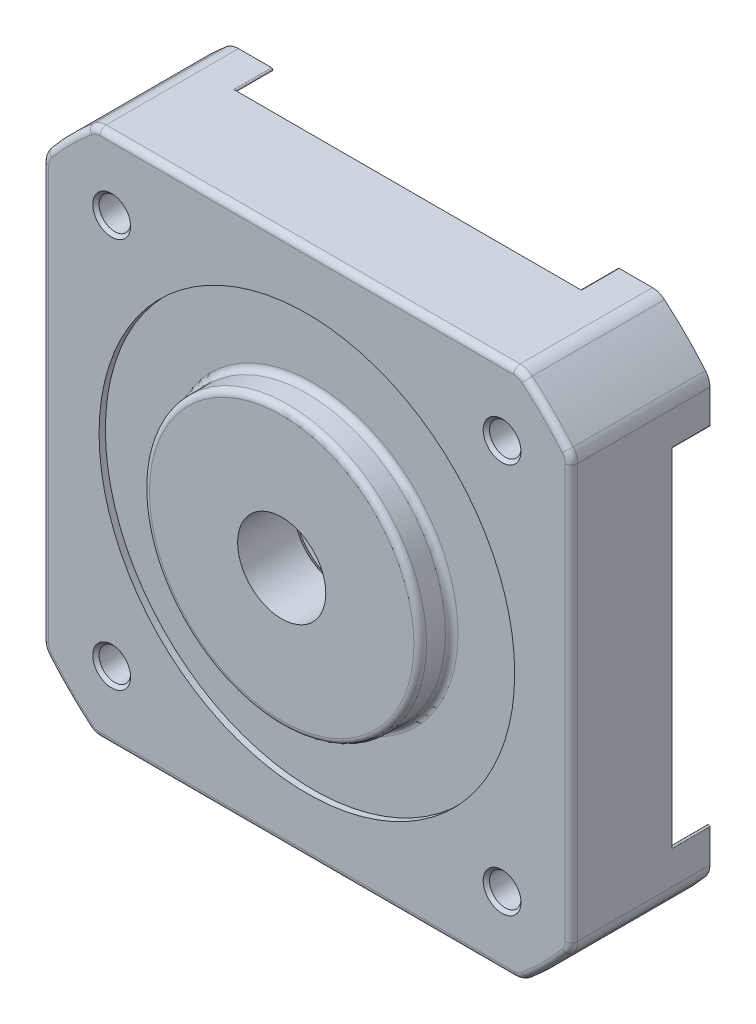
from build123d import *

# Parameters (mm, degrees)
SKETCH1_W                         = 42
SKETCH1_H                         = 42
BOSS_EXTRUDE1_DEPTH               = 8
BOSS_EXTRUDE2_DEPTH               = 3
SKETCH3_R                         = 29.69848481
SKETCH3_R_2                       = 27
CUT_EXTRUDE1_DEPTH                = 11
SKETCH4_R                         = 10
SKETCH4_R_2                       = 8
CUT_EXTRUDE2_DEPTH                = 5
SKETCH5_R                         = 11
BOSS_EXTRUDE3_DEPTH               = 2
CUT_EXTRUDE3_START                = -0.5
SKETCH6_R                         = 16.5
SKETCH6_R_2                       = 11
CUT_EXTRUDE3_DEPTH                = 0.5
FILLET1_R                         = 0.5
FILLET3_R                         = 5
FILLET4_R                         = 1.5
FILLET5_START                     = -4
FILLET5_DEPTH                     = 4
SKETCH7_R                         = 3.5
CUT_EXTRUDE4_DEPTH                = 5
FILLET6_R                         = 0.5
CHAMFER1_SIZE                     = 0.5
FILLET7_R                         = 0.5
TAP_DRILL_FOR_M3_TAP2_D           = 2.5
TAP_DRILL_FOR_M3_TAP2_CSINK_D     = 3
TAP_DRILL_FOR_M3_TAP2_CSINK_ANGLE = 90


with BuildPart() as part:
    # Sketch1 → Boss-Extrude1 (new body)
    with BuildSketch(Plane.XY):
        Rectangle(SKETCH1_W, SKETCH1_H)
    extrude(amount=BOSS_EXTRUDE1_DEPTH)

    # Sketch2 → Boss-Extrude2 (add)
    with BuildSketch(Plane(origin=(0, 0, 0), x_dir=(-1, 0, 0), z_dir=(0, 0, -1))):
        with BuildLine():
            Line((-21, 12.806248475), (-21, 21))
            Line((-21, 21), (-12.806248475, 21))
            ThreePointArc((-12.806248475, 21), (-13.551604467, 20.886303511), (-14.229164972, 20.555555556))
            ThreePointArc((-14.229164972, 20.555555556), (-17.67766953, 17.67766953), (-20.555555556, 14.229164972))
            ThreePointArc((-20.555555556, 14.229164972), (-20.886303511, 13.551604467), (-21, 12.806248475))
        make_face()
        with BuildLine():
            Line((-21, -12.806248475), (-21, -21))
            Line((-21, -21), (-12.806248475, -21))
            ThreePointArc((-12.806248475, -21), (-13.551604467, -20.886303511), (-14.229164972, -20.555555556))
            ThreePointArc((-14.229164972, -20.555555556), (-17.67766953, -17.67766953), (-20.555555556, -14.229164972))
            ThreePointArc((-20.555555556, -14.229164972), (-20.886303511, -13.551604467), (-21, -12.806248475))
        make_face()
        with BuildLine():
            Line((21, 21), (12.806248475, 21))
            ThreePointArc((12.806248475, 21), (13.551604467, 20.886303511), (14.229164972, 20.555555556))
            ThreePointArc((14.229164972, 20.555555556), (17.67766953, 17.67766953), (20.555555556, 14.229164972))
            ThreePointArc((20.555555556, 14.229164972), (20.886303511, 13.551604467), (21, 12.806248475))
            Line((21, 12.806248475), (21, 21))
        make_face()
        with BuildLine():
            Line((21, -12.806248475), (21, -21))
            Line((21, -21), (12.806248475, -21))
            ThreePointArc((12.806248475, -21), (13.551604467, -20.886303511), (14.229164972, -20.555555556))
            ThreePointArc((14.229164972, -20.555555556), (17.67766953, -17.67766953), (20.555555556, -14.229164972))
            ThreePointArc((20.555555556, -14.229164972), (20.886303511, -13.551604467), (21, -12.806248475))
        make_face()
    extrude(amount=BOSS_EXTRUDE2_DEPTH)

    # Sketch3 → Cut-Extrude1 (cut)
    with BuildSketch(Plane(origin=(0, 0, -3), x_dir=(-1, 0, 0), z_dir=(0, 0, -1))):
        Circle(SKETCH3_R)
        Circle(SKETCH3_R_2, mode=Mode.SUBTRACT)
    extrude(amount=-CUT_EXTRUDE1_DEPTH, mode=Mode.SUBTRACT)

    # Sketch4 → Cut-Extrude2 (cut)
    # profile 1 of 2: a face of its own
    with BuildSketch(Plane(origin=(0, 0, 0), x_dir=(-1, 0, 0), z_dir=(0, 0, -1))):
        Polygon((7.870057685, -19), (19, -7.870057685), (19, 7.870057685), (7.870057685, 19), (-7.870057685, 19), (-19, 7.870057685), (-19, -7.870057685), (-7.870057685, -19), align=None)
        Circle(SKETCH4_R, mode=Mode.SUBTRACT)
    # profile 2 of 2: a face of its own
    with BuildSketch(Plane(origin=(0, 0, 0), x_dir=(-1, 0, 0), z_dir=(0, 0, -1))):
        Circle(SKETCH4_R_2)
    extrude(amount=-CUT_EXTRUDE2_DEPTH, mode=Mode.SUBTRACT)

    # Sketch5 → Boss-Extrude3 (add)
    with BuildSketch(Plane.XY.offset(8)):
        Circle(SKETCH5_R)
    extrude(amount=BOSS_EXTRUDE3_DEPTH)

    # Sketch6 → Cut-Extrude3 (cut)
    with BuildSketch(Plane.XY.offset(8).offset(CUT_EXTRUDE3_START)):
        Circle(SKETCH6_R)
        Circle(SKETCH6_R_2, mode=Mode.SUBTRACT)
    extrude(amount=CUT_EXTRUDE3_DEPTH, mode=Mode.SUBTRACT)

    # Fillet1
    fillet1_edges = [part.edges().sort_by_distance(p)[0] for p in [
        (-11, 0, 10),
        (-11, 0, 7.5),
    ]]
    fillet(fillet1_edges, radius=FILLET1_R)

    # Fillet3
    fillet3_edges = [part.edges().sort_by_distance(p)[0] for p in [
        (-19, -7.870057685, 2.5),
        (-7.870057685, -19, 2.5),
        (7.870057685, -19, 2.5),
        (19, -7.870057685, 2.5),
        (19, 7.870057685, 2.5),
        (7.870057685, 19, 2.5),
        (-7.870057685, 19, 2.5),
        (-19, 7.870057685, 2.5),
    ]]
    fillet(fillet3_edges, radius=FILLET3_R)

    # Fillet4
    fillet4_edges = [part.edges().sort_by_distance(p)[0] for p in [
        (21, 16.970562748, 2.5),
        (21, -16.970562748, 2.5),
        (-16.970562748, 21, 2.5),
        (16.970562748, 21, 2.5),
        (-21, -16.970562748, 2.5),
        (-21, 16.970562748, 2.5),
        (16.970562748, -21, 2.5),
        (-16.970562748, -21, 2.5),
    ]]
    fillet(fillet4_edges, radius=FILLET4_R)

    # Fillet5: read off the stored shape, not the designer's step
    # Fillet5 outline → Fillet5 (cut)
    with BuildSketch(Plane.XY.offset(FILLET5_START)):
        with BuildLine():
            ThreePointArc((-13.767786936, 20.807692308), (-13.296538813, 20.95145169), (-12.806248475, 21))
            Line((-12.806248475, 21), (-13.806248475, 21))
            ThreePointArc((-13.806248475, 21), (-13.708190407, 20.919611614), (-13.767786936, 20.807692308))
        make_face()
        with BuildLine():
            ThreePointArc((13.767786936, 20.807692308), (13.708190407, 20.919611614), (13.806248475, 21))
            Line((13.806248475, 21), (12.806248475, 21))
            ThreePointArc((12.806248475, 21), (13.296538813, 20.95145169), (13.767786936, 20.807692308))
        make_face()
        with BuildLine():
            Line((21, -13.806248475), (21, -12.806248475))
            ThreePointArc((21, -12.806248475), (20.95145169, -13.296538813), (20.807692308, -13.767786936))
            ThreePointArc((20.807692308, -13.767786936), (20.919611614, -13.708190407), (21, -13.806248475))
        make_face()
        with BuildLine():
            ThreePointArc((21, 13.806248475), (20.919611614, 13.708190407), (20.807692308, 13.767786936))
            ThreePointArc((20.807692308, 13.767786936), (20.95145169, 13.296538813), (21, 12.806248475))
            Line((21, 12.806248475), (21, 13.806248475))
        make_face()
        with BuildLine():
            Line((-13.806248475, -21), (-12.806248475, -21))
            ThreePointArc((-12.806248475, -21), (-13.296538813, -20.95145169), (-13.767786936, -20.807692308))
            ThreePointArc((-13.767786936, -20.807692308), (-13.708190407, -20.919611614), (-13.806248475, -21))
        make_face()
        with BuildLine():
            ThreePointArc((13.806248475, -21), (13.708190407, -20.919611614), (13.767786936, -20.807692308))
            ThreePointArc((13.767786936, -20.807692308), (13.296538813, -20.95145169), (12.806248475, -21))
            Line((12.806248475, -21), (13.806248475, -21))
        make_face()
        with BuildLine():
            Line((-21, 13.806248475), (-21, 12.806248475))
            ThreePointArc((-21, 12.806248475), (-20.95145169, 13.296538813), (-20.807692308, 13.767786936))
            ThreePointArc((-20.807692308, 13.767786936), (-20.919611614, 13.708190407), (-21, 13.806248475))
        make_face()
        with BuildLine():
            ThreePointArc((-21, -13.806248475), (-20.919611614, -13.708190407), (-20.807692308, -13.767786936))
            ThreePointArc((-20.807692308, -13.767786936), (-20.95145169, -13.296538813), (-21, -12.806248475))
            Line((-21, -12.806248475), (-21, -13.806248475))
        make_face()
    extrude(amount=FILLET5_DEPTH, mode=Mode.SUBTRACT)

    # Sketch7 → Cut-Extrude4 (cut)
    with BuildSketch(Plane(origin=(0, 0, 5), x_dir=(-1, 0, 0), z_dir=(0, 0, -1))):
        Circle(SKETCH7_R)
    extrude(amount=-CUT_EXTRUDE4_DEPTH, mode=Mode.SUBTRACT)

    # Fillet6
    fillet6_edges = [part.edges().sort_by_distance(p)[0] for p in [
        (10, 0, 5),
        (-13.435028843, -13.435028843, 5),
        (0, -19, 5),
        (-19, 0, 5),
        (-13.435028843, 13.435028843, 5),
        (0, 19, 5),
        (13.435028843, 13.435028843, 5),
        (19, 0, 5),
        (13.435028843, -13.435028843, 5),
        (7.712407035, 18.619397663, 5),
        (-18.619397663, -7.712407035, 5),
        (-18.619397663, 7.712407035, 5),
        (-7.712407035, 18.619397663, 5),
        (18.619397663, 7.712407035, 5),
        (18.619397663, -7.712407035, 5),
        (7.712407035, -18.619397663, 5),
        (-7.712407035, -18.619397663, 5),
    ]]
    fillet(fillet6_edges, radius=FILLET6_R)

    # Chamfer1
    chamfer1_edges = [part.edges().sort_by_distance(p)[0] for p in [
        (10, 0, 0),
        (3.5, 0, 5),
    ]]
    chamfer(chamfer1_edges, length=CHAMFER1_SIZE)

    # Fillet7
    fillet7_edges = [part.edges().sort_by_distance(p)[0] for p in [
        (19.091883092, -19.091883092, 8),
        (21, 0, 8),
        (19.091883092, 19.091883092, 8),
        (0, 21, 8),
        (-19.091883092, 19.091883092, 8),
        (-21, 0, 8),
        (-19.091883092, -19.091883092, 8),
        (0, -21, 8),
        (-16.946172481, -20.909004655, 8),
        (20.909004655, 16.946172481, 8),
        (16.946172481, 20.909004655, 8),
        (-16.946172481, 20.909004655, 8),
        (-20.909004655, 16.946172481, 8),
        (-20.909004655, -16.946172481, 8),
        (16.946172481, -20.909004655, 8),
        (20.909004655, -16.946172481, 8),
    ]]
    fillet(fillet7_edges, radius=FILLET7_R)

    # Tap Drill for M3 Tap2 (through all)
    with Locations(Plane.XY.offset(8)):
        with Locations((-15.5, 15.5), (15.5, -15.5), (-15.5, -15.5), (15.5, 15.5)):
            CounterSinkHole(TAP_DRILL_FOR_M3_TAP2_D / 2, TAP_DRILL_FOR_M3_TAP2_CSINK_D / 2, counter_sink_angle=TAP_DRILL_FOR_M3_TAP2_CSINK_ANGLE)


solid = part.part
